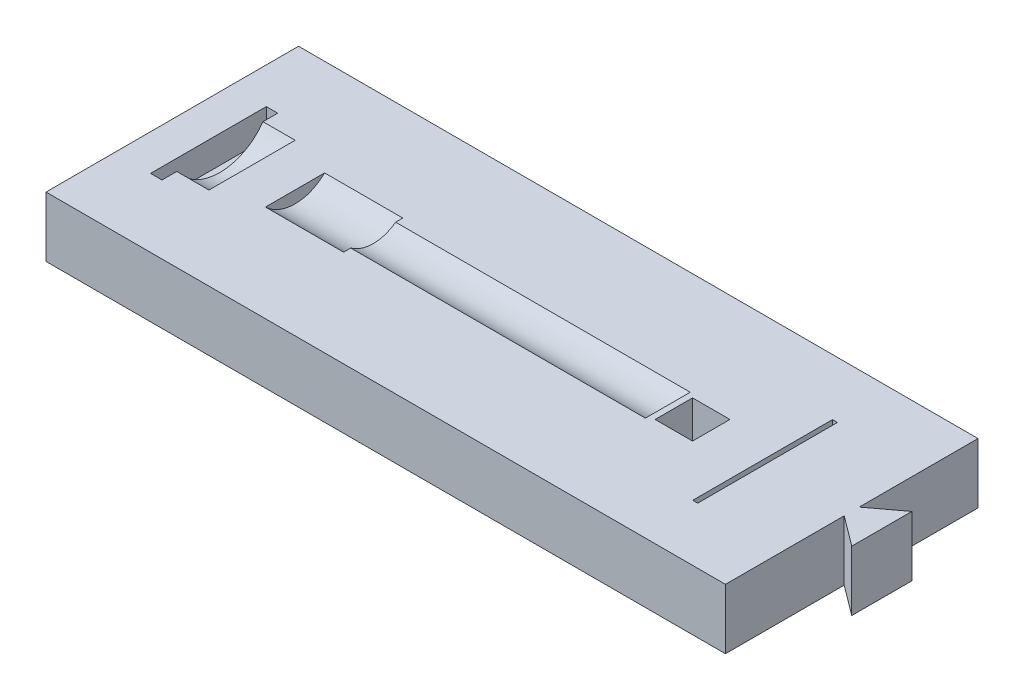
from build123d import *

# Parameters (mm, degrees)
SKETCH1_W           = 226
SKETCH1_H           = 84
BOSS_EXTRUDE1_DEPTH = 20
BOSS_EXTRUDE2_DEPTH = 20
SKETCH4_W           = 1.65
SKETCH4_H           = 46.5
BOSS_EXTRUDE3_DEPTH = 5
SKETCH4_2_W         = 1.65
SKETCH4_2_H         = 46.5
CUT_EXTRUDE1_DEPTH  = 5
CAVITY2_START       = 416.690531323
CAVITY2_DEPTH       = 123.991681054
CAVITY2_START_2     = 387.890531323
CAVITY2_2_DEPTH     = 14.5
CAVITY2_3_DEPTH     = 3.8
CAVITY2_4_DEPTH     = 26
CAVITY2_START_3     = 542.682212377
CAVITY2_5_DEPTH     = 12.45
CAVITY2_6_OUTLINE_W = 10.967659298
CAVITY2_6_OUTLINE_H = 10.05
CAVITY2_6_DEPTH     = 1.2
CAVITY2_START_4     = 553.932212377
CAVITY2_7_OUTLINE_W = 10.967659298
CAVITY2_7_OUTLINE_H = 10.05
CAVITY2_7_DEPTH     = 1.2
SKETCH7_W           = 10.05
SKETCH7_H           = 10.05
CUT_EXTRUDE2_DEPTH  = 12


# Read off the part's stored shape, not the designer's step: Cavity2
with BuildPart() as part:
    # Sketch1 → Boss-Extrude1 (new body)
    with BuildSketch(Plane(origin=(375.872687737, 0, 1298.443562055), x_dir=(1, 0, 0), z_dir=(0, 1, 0))):
        with Locations((113, -81.370523073)):
            Rectangle(SKETCH1_W, SKETCH1_H)
    extrude(amount=BOSS_EXTRUDE1_DEPTH)

    # Sketch2 → Boss-Extrude2 (add)
    with BuildSketch(Plane.XZ):
        Polygon((601.872687737, 1377.314085128), (601.872687737, 1382.314085128), (611.872687737, 1389.814085128), (611.872687737, 1369.814085128), align=None)
    extrude(amount=-BOSS_EXTRUDE2_DEPTH)

    # Sketch4 → Boss-Extrude3 (add)
    with BuildSketch(Plane(origin=(0, 20, 0), x_dir=(1, 0, 0), z_dir=(0, 1, 0))):
        with Locations((573.047687737, -1379.814085128)):
            Rectangle(SKETCH4_W, SKETCH4_H)
    extrude(amount=-BOSS_EXTRUDE3_DEPTH)

    # Sketch4<2> → Cut-Extrude1 (cut)
    with BuildSketch(Plane(origin=(0, 20, 0), x_dir=(1, 0, 0), z_dir=(0, 1, 0))):
        with Locations((573.047687737, -1379.814085128)):
            Rectangle(SKETCH4_2_W, SKETCH4_2_H)
    extrude(amount=-CUT_EXTRUDE1_DEPTH, mode=Mode.SUBTRACT)

    # Cavity2 outline → Cavity2 (cut)
    with BuildSketch(Plane.YZ.offset(CAVITY2_START)):
        with BuildLine():
            ThreePointArc((20, 1387.257061845), (17.532340702, 1379.800377592), (20, 1372.34369334))
            Line((20, 1372.34369334), (20, 1387.257061845))
        make_face()
    extrude(amount=CAVITY2_DEPTH, mode=Mode.SUBTRACT)

    # Cavity2 2 outline → Cavity2 2 (cut)
    with BuildSketch(Plane.YZ.offset(CAVITY2_START_2)):
        with BuildLine():
            ThreePointArc((20, 1394.13921088), (12.532340702, 1379.800377593), (20, 1365.461544305))
            Line((20, 1365.461544305), (20, 1394.13921088))
        make_face()
    extrude(amount=CAVITY2_2_DEPTH, mode=Mode.SUBTRACT)

    # Cavity2 3 outline → Cavity2 3 (cut)
    with BuildSketch(Plane.YZ.offset(CAVITY2_START_2)):
        with BuildLine():
            Line((20, 1394.13921088), (20, 1399.050377582))
            Line((20, 1399.050377582), (10.782340682, 1399.050377573))
            Line((10.782340682, 1399.050377573), (10.782340722, 1360.550377573))
            Line((10.782340722, 1360.550377573), (20, 1360.550377582))
            Line((20, 1360.550377582), (20, 1365.461544305))
            ThreePointArc((20, 1365.461544305), (12.532340702, 1379.800377593), (20, 1394.13921088))
        make_face()
    extrude(amount=CAVITY2_3_DEPTH, mode=Mode.SUBTRACT)

    # Cavity2 4 outline → Cavity2 4 (cut)
    with BuildSketch(Plane.YZ.offset(CAVITY2_START)):
        with BuildLine():
            Line((20, 1387.257061845), (20, 1389.636771243))
            ThreePointArc((20, 1389.636771243), (15.982340702, 1379.800377593), (20, 1369.963983943))
            Line((20, 1369.963983943), (20, 1372.34369334))
            ThreePointArc((20, 1372.34369334), (17.532340702, 1379.800377592), (20, 1387.257061845))
        make_face()
    extrude(amount=CAVITY2_4_DEPTH, mode=Mode.SUBTRACT)

    # Cavity2 5 outline → Cavity2 5 (cut)
    with BuildSketch(Plane.YZ.offset(CAVITY2_START_3)):
        Polygon((20, 1386.025377593), (7.832340702, 1386.025377593), (7.832340702, 1373.575377593), (20, 1373.575377593), (20, 1374.775377593), (9.032340702, 1374.775377593), (9.032340702, 1384.825377593), (20, 1384.825377593), align=None)
    extrude(amount=CAVITY2_5_DEPTH, mode=Mode.SUBTRACT)

    # Cavity2 6 outline → Cavity2 6 (cut)
    with BuildSketch(Plane.YZ.offset(CAVITY2_START_3)):
        with Locations((14.516170351, 1379.800377593)):
            Rectangle(CAVITY2_6_OUTLINE_W, CAVITY2_6_OUTLINE_H)
    extrude(amount=CAVITY2_6_DEPTH, mode=Mode.SUBTRACT)

    # Cavity2 7 outline → Cavity2 7 (cut)
    with BuildSketch(Plane.YZ.offset(CAVITY2_START_4)):
        with Locations((14.516170351, 1379.800377593)):
            Rectangle(CAVITY2_7_OUTLINE_W, CAVITY2_7_OUTLINE_H)
    extrude(amount=CAVITY2_7_DEPTH, mode=Mode.SUBTRACT)

    # Sketch7 → Cut-Extrude2 (cut)
    with BuildSketch(Plane(origin=(0, 20, 0), x_dir=(1, 0, 0), z_dir=(0, 1, 0))):
        with Locations((548.907212377, -1379.800377593)):
            Rectangle(SKETCH7_W, SKETCH7_H)
    extrude(amount=-CUT_EXTRUDE2_DEPTH, mode=Mode.SUBTRACT)


solid = part.part
